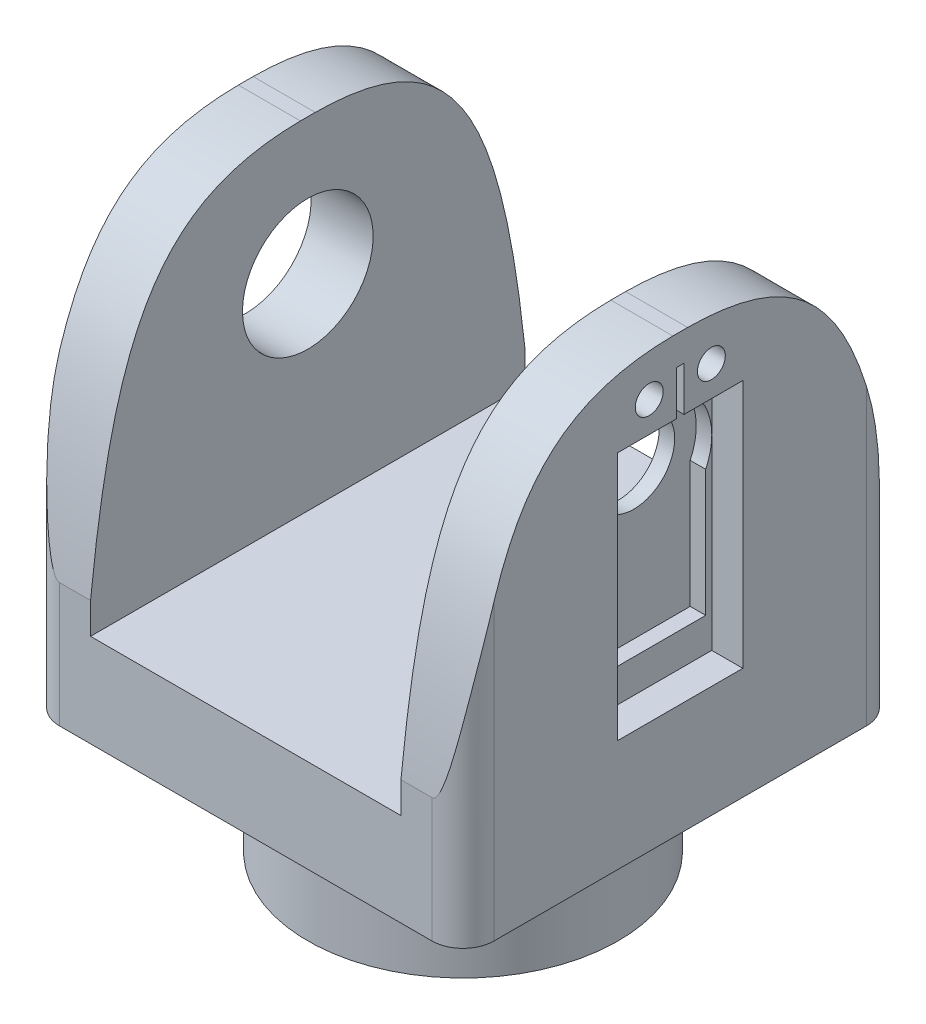
from build123d import *
from build123d.topology import SkipClean

# Parameters (mm, degrees)
SKETCH1_W           = 70
SKETCH1_H           = 70
BOSS_EXTRUDE1_DEPTH = 20
SKETCH3_W           = 10
SKETCH3_H           = 70
BOSS_EXTRUDE2_DEPTH = 50
SKETCH4_R           = 25
SKETCH4_R_2         = 20.325
BOSS_EXTRUDE3_DEPTH = 20
FILLET1_R           = 10
SKETCH5_W           = 20.15
SKETCH5_H           = 40.15
CUT_EXTRUDE1_DEPTH  = 5
CUT_EXTRUDE3_DEPTH  = 140
CUT_EXTRUDE4_DEPTH  = 2.5
SKETCH9_W           = 50
SKETCH9_H           = 70
CUT_EXTRUDE5_DEPTH  = 5
SKETCH8_4_R         = 6.6
SKETCH8_4_R_2       = 3.1
CUT_EXTRUDE8_DEPTH  = 6
SKETCH12_R          = 2.25
CUT_EXTRUDE9_DEPTH  = 8
SKETCH12_3_W        = 1.2
SKETCH12_3_H        = 7.15
CUT_EXTRUDE10_DEPTH = 1.6
SKETCH8_5_R         = 3.1
CUT_EXTRUDE11_DEPTH = 10
SKETCH13_R          = 10.525
CUT_EXTRUDE12_DEPTH = 10
FILLET2_R           = 5


with BuildPart() as part:
    # Sketch1 → Boss-Extrude1 (new body)
    with BuildSketch(Plane(origin=(0, 0, 0), x_dir=(1, 0, 0), z_dir=(0, 1, 0))):
        Rectangle(SKETCH1_W, SKETCH1_H)
    extrude(amount=BOSS_EXTRUDE1_DEPTH)

    # Sketch3 → Boss-Extrude2 (add)
    with BuildSketch(Plane(origin=(0, 20, 0), x_dir=(1, 0, 0), z_dir=(0, 1, 0))):
        with Locations((-30, 0)):
            Rectangle(SKETCH3_W, SKETCH3_H)
        with Locations((30, 0)):
            Rectangle(SKETCH3_W, SKETCH3_H)
    extrude(amount=BOSS_EXTRUDE2_DEPTH)

    # Sketch4 → Boss-Extrude3 (add)
    with BuildSketch(Plane(origin=(0, -20, 0), x_dir=(-1, 0, 0), z_dir=(0, -1, 0))):
        with Locations(Location((0, 0, 0), (0, 0, 90))):
            Circle(SKETCH4_R)
        with Locations(Location((0, 0, 0), (0, 0, 90))):
            Circle(SKETCH4_R_2, mode=Mode.SUBTRACT)
    extrude(amount=-BOSS_EXTRUDE3_DEPTH)

    # Fillet1
    fillet1_edges = [part.edges().sort_by_distance(p)[0] for p in [
        (0, 0, 25),
    ]]
    fillet(fillet1_edges, radius=FILLET1_R - 0.0001)  # a hair under: the kernel refuses the full size

    # Sketch5 → Cut-Extrude1 (cut)
    with BuildSketch(Plane(origin=(35, 0, 0), x_dir=(0, 0, -1), z_dir=(1, 0, 0))):
        with Locations((0, 38.075)):
            Rectangle(SKETCH5_W, SKETCH5_H)
    extrude(amount=-CUT_EXTRUDE1_DEPTH, mode=Mode.SUBTRACT)

    # Sketch6 → Cut-Extrude3 (cut)
    with BuildSketch(Plane(origin=(35, 0, 0), x_dir=(0, 0, -1), z_dir=(1, 0, 0))):
        with BuildLine():
            Line((-35, 70), (-35, 20))
            add(Edge.make_bspline(
                [(-35, 20), (-31.043970013, 56.876347524), (-23.178818695, 69.774444442), (-1.193819381, 70)],
                knots=[0, 0, 0, 0, 0.690984823, 0.690984823, 0.690984823, 0.690984823], degree=3))
            Line((-1.193819381, 70), (-35, 70))
        make_face()
        with BuildLine():
            add(Edge.make_bspline(
                [(35, 20), (31.043970013, 56.876347524), (23.178818695, 69.774444442), (1.193819381, 70)],
                knots=[0, 0, 0, 0, 0.690984823, 0.690984823, 0.690984823, 0.690984823], degree=3))
            Line((35, 20), (35, 70))
            Line((35, 70), (1.193819381, 70))
        make_face()
    extrude(amount=-CUT_EXTRUDE3_DEPTH, mode=Mode.SUBTRACT)

    # Sketch8 → Cut-Extrude4 (cut)
    with BuildSketch(Plane(origin=(30, 0, 0), x_dir=(0, 0, -1), z_dir=(1, 0, 0))):
        with BuildLine():
            ThreePointArc((10.075, 48.075), (7.124100826, 55.199100815), (1.7e-08, 58.15))
            ThreePointArc((1.7e-08, 58.15), (-7.124100815, 55.199100826), (-10.075, 48.075))
            ThreePointArc((-10.075, 48.075), (-9.828227841, 45.858795474), (-9.1, 43.751156224))
            Line((-9.1, 43.751156224), (-9.1, 48.075))
            Line((-9.1, 48.075), (-6.6, 48.075))
            ThreePointArc((-6.6, 48.075), (0, 54.675), (6.6, 48.075))
            Line((6.6, 48.075), (9.1, 48.075))
            Line((9.1, 48.075), (9.1, 43.751156224))
            ThreePointArc((9.1, 43.751156224), (9.828227841, 45.858795474), (10.075, 48.075))
        make_face()
        with BuildLine():
            Line((-9.1, 48.075), (-9.1, 43.751156224))
            ThreePointArc((-9.1, 43.751156224), (0, 38), (9.1, 43.751156224))
            Line((9.1, 43.751156224), (9.1, 48.075))
            Line((9.1, 48.075), (6.6, 48.075))
            ThreePointArc((6.6, 48.075), (0, 41.475), (-6.6, 48.075))
            Line((-6.6, 48.075), (-9.1, 48.075))
        make_face()
        with BuildLine():
            ThreePointArc((9.1, 43.751156224), (0, 38), (-9.1, 43.751156224))
            Line((-9.1, 43.751156224), (-9.1, 23.375))
            Line((-9.1, 23.375), (9.1, 23.375))
            Line((9.1, 23.375), (9.1, 43.751156224))
        make_face()
        with BuildLine():
            ThreePointArc((6.6, 48.075), (0, 54.675), (-6.6, 48.075))
            Line((-6.6, 48.075), (-3.1, 48.075))
            ThreePointArc((-3.1, 48.075), (0, 51.175), (3.1, 48.075))
            Line((3.1, 48.075), (6.6, 48.075))
        make_face()
        with BuildLine():
            Line((-3.1, 48.075), (-6.6, 48.075))
            ThreePointArc((-6.6, 48.075), (0, 41.475), (6.6, 48.075))
            Line((6.6, 48.075), (3.1, 48.075))
            ThreePointArc((3.1, 48.075), (0, 44.975), (-3.1, 48.075))
        make_face()
    extrude(amount=-CUT_EXTRUDE4_DEPTH, mode=Mode.SUBTRACT)

    # Sketch9 → Cut-Extrude5 (cut)
    with BuildSketch(Plane(origin=(0, 20, 0), x_dir=(1, 0, 0), z_dir=(0, 1, 0))):
        Rectangle(SKETCH9_W, SKETCH9_H)
    extrude(amount=-CUT_EXTRUDE5_DEPTH, mode=Mode.SUBTRACT)

    # Sketch8<4> → Cut-Extrude8 (cut)
    with SkipClean():  # the faces are left unmerged after this step: merging them gives an invalid solid
        with BuildSketch(Plane(origin=(30, 0, 0), x_dir=(0, 0, -1), z_dir=(1, 0, 0))):
            with Locations((0, 48.075)):
                Circle(SKETCH8_4_R)
            with Locations((0, 48.075)):
                Circle(SKETCH8_4_R_2, mode=Mode.SUBTRACT)
        extrude(amount=-CUT_EXTRUDE8_DEPTH, mode=Mode.SUBTRACT)


with BuildPart() as cut_extrude8_piece_1:
    # of the separate pieces the step leaves, piece 1, a body of its own (cut_extrude8_pieces)
    add(part.part.solids().sort_by_distance((0, 0, -34.9999))[0])

    # Sketch12 → Cut-Extrude9 (cut)
    with BuildSketch(Plane(origin=(35, 0, 0), x_dir=(0, 0, -1), z_dir=(1, 0, 0))):
        with Locations((-5.005, 63.05)):
            Circle(SKETCH12_R)
        with Locations((5.005, 63.05)):
            Circle(SKETCH12_R)
    extrude(amount=-CUT_EXTRUDE9_DEPTH, mode=Mode.SUBTRACT)

    # Sketch12<3> → Cut-Extrude10 (cut)
    with BuildSketch(Plane(origin=(35, 0, 0), x_dir=(0, 0, -1), z_dir=(1, 0, 0))):
        with Locations((0, 61.725)):
            Rectangle(SKETCH12_3_W, SKETCH12_3_H)
    extrude(amount=-CUT_EXTRUDE10_DEPTH, mode=Mode.SUBTRACT)

    # Sketch13 → Cut-Extrude12 (cut)
    with BuildSketch(Plane.ZY.offset(35)):
        with Locations((0, 48.075)):
            Circle(SKETCH13_R)
    extrude(amount=-CUT_EXTRUDE12_DEPTH, mode=Mode.SUBTRACT)

    # Fillet2
    fillet2_edges = [cut_extrude8_piece_1.edges().sort_by_distance(p)[0] for p in [
        (-35, 10, 35),
        (35, 10, 35),
        (35, 10, -35),
        (-35, 10, -35),
    ]]
    fillet(fillet2_edges, radius=FILLET2_R)


with BuildPart() as cut_extrude8_piece_2:
    # of the separate pieces the step leaves, piece 2, a body of its own (cut_extrude8_pieces)
    add(part.part.solids().sort_by_distance((25, 48.075, -3.1))[0])

    # Sketch8<5> → Cut-Extrude11 (cut)
    with BuildSketch(Plane(origin=(30, 0, 0), x_dir=(0, 0, -1), z_dir=(1, 0, 0))):
        with Locations((0, 48.075)):
            Circle(SKETCH8_5_R)
    extrude(amount=-CUT_EXTRUDE11_DEPTH, mode=Mode.SUBTRACT)


solid = cut_extrude8_piece_1.part
